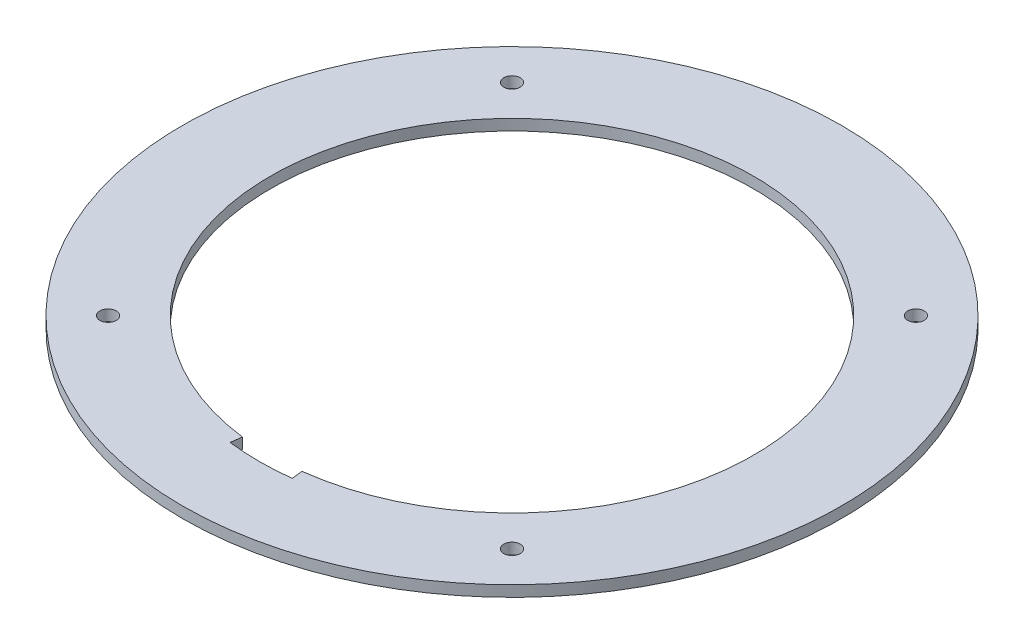
from build123d import *

# Parameters (mm, degrees)
SKETCH_1_R             = 60
SM_BASE_FLANGE_1_DEPTH = 2
CUT_EXTRUDE_1_REACH    = 86.876
SKETCH_6_R             = 1.5


# Sheet-metal steps are written as plain solids
with BuildPart() as part:
    # Sketch 1 → 基体-法兰1 (new body)
    with BuildSketch(Plane(origin=(0, 0, 0), x_dir=(1, 0, 0), z_dir=(0, 1, 0))):
        with Locations(Location((0, 0, 0), (0, 0, 270))):
            Circle(SKETCH_1_R)
        with BuildLine():
            Line((-5.662691153, -45.650125179), (-5.41648719, -43.665337128))
            ThreePointArc((-5.41648719, -43.665337128), (-0.000329002, 43.999999999), (5.41714019, -43.665256122))
            Line((5.41714019, -43.665256122), (5.663373835, -45.650040491))
            ThreePointArc((5.663373835, -45.650040491), (0.000343957, -45.999999999), (-5.662691153, -45.650125179))
        make_face(mode=Mode.SUBTRACT)
    extrude(amount=-SM_BASE_FLANGE_1_DEPTH)

    # 草图6 → 切除-拉伸1 (cut, up to next)
    with BuildSketch(Plane(origin=(0, 0, 0), x_dir=(1, 0, 0), z_dir=(0, 1, 0)), mode=Mode.PRIVATE) as cut_extrude_1_sk1:
        with Locations(Location((36.769552622, 36.769552622, 0), (0, 0, 270))):
            Circle(SKETCH_6_R)
    cut_extrude_1_tool1 = extrude(cut_extrude_1_sk1.sketch, amount=-CUT_EXTRUDE_1_REACH, mode=Mode.PRIVATE) & part.part
    # 草图6 → 切除-拉伸1 (cut, up to next)
    with BuildSketch(Plane(origin=(0, 0, 0), x_dir=(1, 0, 0), z_dir=(0, 1, 0)), mode=Mode.PRIVATE) as cut_extrude_1_sk2:
        with Locations(Location((-36.769552622, 36.769552622, 0), (0, 0, 270))):
            Circle(SKETCH_6_R)
    cut_extrude_1_tool2 = extrude(cut_extrude_1_sk2.sketch, amount=-CUT_EXTRUDE_1_REACH, mode=Mode.PRIVATE) & part.part
    # 草图6 → 切除-拉伸1 (cut, up to next)
    with BuildSketch(Plane(origin=(0, 0, 0), x_dir=(1, 0, 0), z_dir=(0, 1, 0)), mode=Mode.PRIVATE) as cut_extrude_1_sk3:
        with Locations(Location((36.769552622, -36.769552622, 0), (0, 0, 270))):
            Circle(SKETCH_6_R)
    cut_extrude_1_tool3 = extrude(cut_extrude_1_sk3.sketch, amount=-CUT_EXTRUDE_1_REACH, mode=Mode.PRIVATE) & part.part
    # 草图6 → 切除-拉伸1 (cut, up to next)
    with BuildSketch(Plane(origin=(0, 0, 0), x_dir=(1, 0, 0), z_dir=(0, 1, 0)), mode=Mode.PRIVATE) as cut_extrude_1_sk4:
        with Locations(Location((-36.769552622, -36.769552622, 0), (0, 0, 270))):
            Circle(SKETCH_6_R)
    cut_extrude_1_tool4 = extrude(cut_extrude_1_sk4.sketch, amount=-CUT_EXTRUDE_1_REACH, mode=Mode.PRIVATE) & part.part
    add(cut_extrude_1_tool1.solids().sort_by_distance((36.769553, 0, -36.769553))[0], mode=Mode.SUBTRACT)
    add(cut_extrude_1_tool2.solids().sort_by_distance((-36.769553, 0, -36.769553))[0], mode=Mode.SUBTRACT)
    add(cut_extrude_1_tool3.solids().sort_by_distance((36.769553, 0, 36.769553))[0], mode=Mode.SUBTRACT)
    add(cut_extrude_1_tool4.solids().sort_by_distance((-36.769553, 0, 36.769553))[0], mode=Mode.SUBTRACT)


solid = part.part
